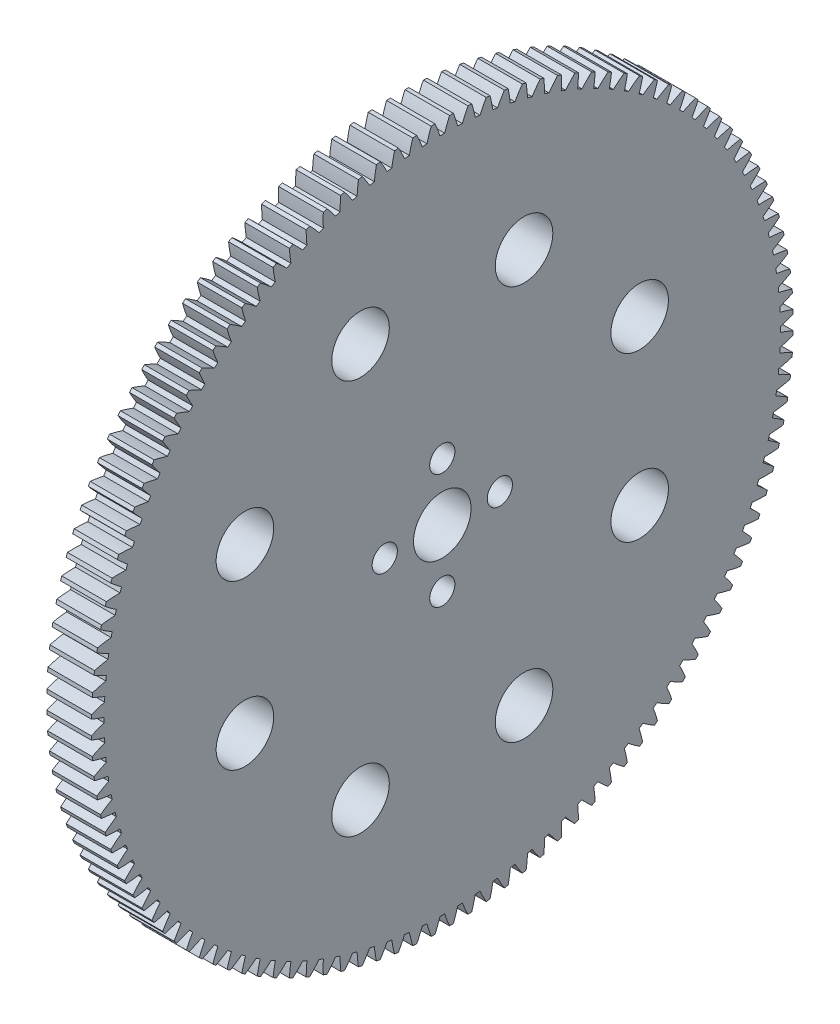
from build123d import *

# Parameters (mm, degrees)
BASPROSKE_W        = 6.2
BASPROSKE_H        = 48.8
TOOTHCUT_DEPTH     = 70.291557927
TEETHCUTS_COUNT    = 120
TEETHCUTS_ANGLE    = 357
BORSKE_R           = 4
BORE_DEPTH         = 50.0000508
SKETCH1_R          = 1.75
CUT_EXTRUDE1_DEPTH = 70.276908996
SKETCH2_R          = 4
CUT_EXTRUDE2_DEPTH = 70.276908996


with BuildPart() as part:
    # BasProSke → Base-Revolve (revolve)
    with BuildSketch(Plane(origin=(0, 0, 0), x_dir=(1, 0, 0), z_dir=(0, 1, 0))):
        with Locations((3.1, 24.4)):
            Rectangle(BASPROSKE_W, BASPROSKE_H)
    revolve(axis=Axis((-10, 0, 0), (1, 0, 0)))

    # TooCutSke → ToothCut (cut, through all)
    with BuildSketch(Plane(origin=(0, 0, 0), x_dir=(0, 0, -1), z_dir=(1, 0, 0))):
        with BuildLine():
            ThreePointArc((0.32782068, 46.997856702), (0, 46.999), (-0.32782068, 46.997856702))
            ThreePointArc((-0.32782068, 46.997856702), (-0.650143085, 47.915062182), (-1.018480109, 48.814776282))
            ThreePointArc((-1.018480109, 48.814776282), (0, 48.8254), (1.018480109, 48.814776282))
            ThreePointArc((1.018480109, 48.814776282), (0.650143085, 47.915062182), (0.32782068, 46.997856702))
        make_face()
    toothcut = extrude(amount=TOOTHCUT_DEPTH, mode=Mode.SUBTRACT)

    # TeethCuts: ToothCut ×120 about axis
    teethcuts_axis = Axis((-10, 0, 0), (1, 0, 0))
    for i in range(1, TEETHCUTS_COUNT):
        add(toothcut.rotate(teethcuts_axis, i * TEETHCUTS_ANGLE / (TEETHCUTS_COUNT - 1)), mode=Mode.SUBTRACT)

    # BorSke → Bore (cut, symmetric)
    with BuildSketch(Plane(origin=(0, 0, 0), x_dir=(0, 0, -1), z_dir=(1, 0, 0))):
        Circle(BORSKE_R)
    extrude(amount=BORE_DEPTH, both=True, mode=Mode.SUBTRACT)

    # Sketch1 → Cut-Extrude1 (cut, through all)
    with BuildSketch(Plane(origin=(6.2, 0, 0), x_dir=(0, 0, -1), z_dir=(1, 0, 0))):
        with Locations((0, 8)):
            Circle(SKETCH1_R)
        with Locations((8, 0)):
            Circle(SKETCH1_R)
        with Locations((0, -8)):
            Circle(SKETCH1_R)
        with Locations((-8, 0)):
            Circle(SKETCH1_R)
    extrude(amount=-CUT_EXTRUDE1_DEPTH, mode=Mode.SUBTRACT)

    # Sketch2 → Cut-Extrude2 (cut, through all)
    with BuildSketch(Plane(origin=(6.2, 0, 0), x_dir=(0, 0, -1), z_dir=(1, 0, 0))):
        with Locations((11.365697941, 27.439222116)):
            Circle(SKETCH2_R)
        with Locations((-11.365697941, -27.439222116)):
            Circle(SKETCH2_R)
        with Locations((27.439222116, -11.365697941)):
            Circle(SKETCH2_R)
        with Locations((-27.439222116, 11.365697941)):
            Circle(SKETCH2_R)
        with Locations((27.439222116, 11.365697941)):
            Circle(SKETCH2_R)
        with Locations((11.365697941, -27.439222116)):
            Circle(SKETCH2_R)
        with Locations((-27.439222116, -11.365697941)):
            Circle(SKETCH2_R)
        with Locations((-11.365697941, 27.439222116)):
            Circle(SKETCH2_R)
    extrude(amount=-CUT_EXTRUDE2_DEPTH, mode=Mode.SUBTRACT)


solid = part.part
